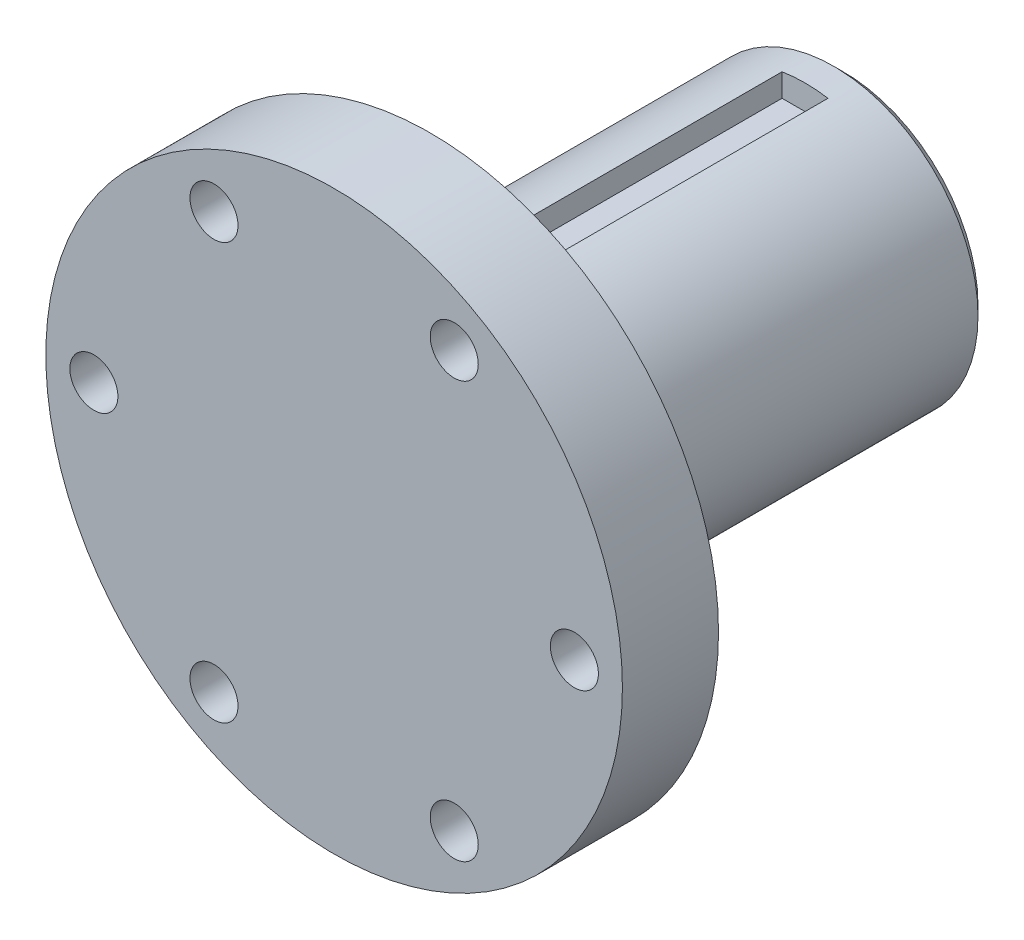
from build123d import *

# Parameters (mm, degrees)
SZKIC1_R                    = 15
DODANIE_WYCI_GNI_CIE1_DEPTH = 53
SFAZOWANIE1_SIZE            = 1
WYTNIJ_WYCI_GNI_CIE1_DEPTH  = 35
SZKIC3_R                    = 30
DODANIE_WYCI_GNI_CIE2_DEPTH = 10
SZKIC4_R                    = 2.5
WYTNIJ_WYCI_GNI_CIE2_DEPTH  = 61.406953242
SZYK_KO_OWY1_COUNT          = 6


with BuildPart() as part:
    # Szkic1 → Dodanie-wyciągnięcie1 (new body)
    with BuildSketch(Plane.XY):
        Circle(SZKIC1_R)
    extrude(amount=DODANIE_WYCI_GNI_CIE1_DEPTH)

    # Sfazowanie1
    sfazowanie1_edges = [part.edges().sort_by_distance(p)[0] for p in [
        (-15, 0, 0),
    ]]
    chamfer(sfazowanie1_edges, length=SFAZOWANIE1_SIZE)

    # Szkic2 → Wytnij-wyciągnięcie1 (cut)
    with BuildSketch(Plane(origin=(0, 0, 4), x_dir=(-1, 0, 0), z_dir=(0, 0, -1))):
        with BuildLine():
            Line((-2.39, 14.808372632), (-2.39, 12.418372632))
            Line((-2.39, 12.418372632), (2.39, 12.418372632))
            Line((2.39, 12.418372632), (2.39, 14.808372632))
            ThreePointArc((2.39, 14.808372632), (0, 15), (-2.39, 14.808372632))
        make_face()
    extrude(amount=-WYTNIJ_WYCI_GNI_CIE1_DEPTH, mode=Mode.SUBTRACT)

    # Szkic3 → Dodanie-wyciągnięcie2 (add)
    with BuildSketch(Plane.XY.offset(53)):
        Circle(SZKIC3_R)
    extrude(amount=-DODANIE_WYCI_GNI_CIE2_DEPTH)

    # Szkic4 → Wytnij-wyciągnięcie2 (cut, through all)
    with BuildSketch(Plane(origin=(0, 0, 43), x_dir=(-1, 0, 0), z_dir=(0, 0, -1))):
        with Locations((-25, 0)):
            Circle(SZKIC4_R)
    wytnij_wyci_gni_cie2 = extrude(amount=-WYTNIJ_WYCI_GNI_CIE2_DEPTH, mode=Mode.SUBTRACT)

    # Szyk kołowy1: Wytnij-wyciągnięcie2 ×6 about axis
    szyk_ko_owy1_axis = Axis((0, 0, 43), (0, 0, 1))
    for i in range(1, SZYK_KO_OWY1_COUNT):
        add(wytnij_wyci_gni_cie2.rotate(szyk_ko_owy1_axis, i * 360 / SZYK_KO_OWY1_COUNT), mode=Mode.SUBTRACT)


solid = part.part
